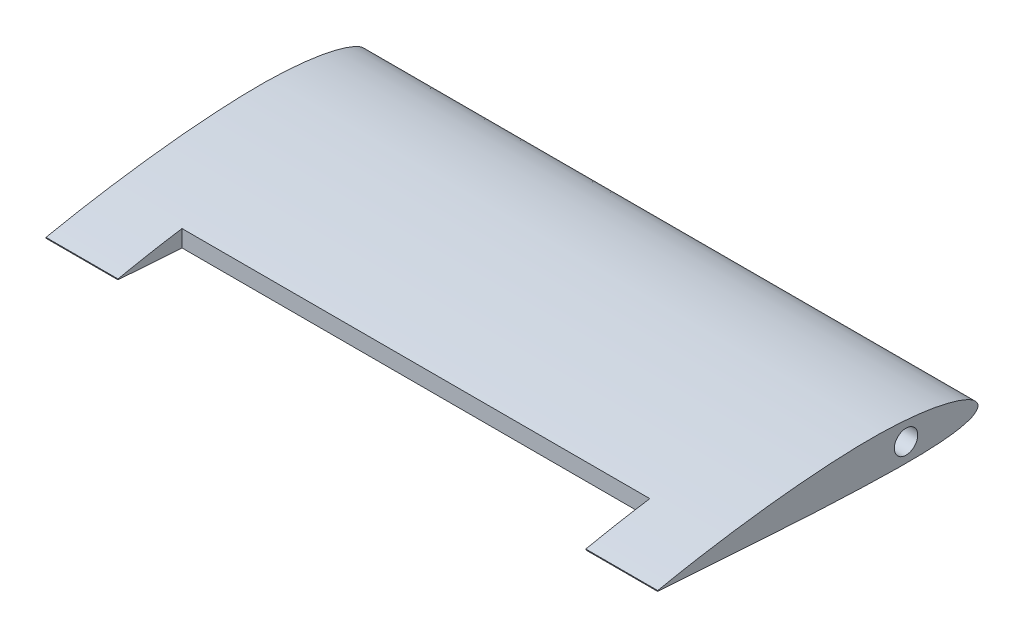
from build123d import *

# Parameters (mm, degrees)
EXTERIOR_DEPTH          = 89
BOSS_EXTRUDE1_DEPTH     = 15
CUT_EXTRUDE1_DEPTH      = 187.402789831
BOSS_EXTRUDE2_DEPTH     = 170
CUT_EXTRUDE6_DEPTH      = 195.066998874
CUT_EXTRUDE2_DEPTH      = 194.966819744
CUT_EXTRUDE2_DEPTH_BACK = 194.966819744
SKETCH13_R              = 3.25
SKETCH19_W              = 37
SKETCH19_H              = 36
CUT_EXTRUDE7_DEPTH      = 23
SKETCH20_W              = 130
SKETCH20_H              = 17.8
CUT_EXTRUDE8_DEPTH      = 266.663791417


with BuildPart() as part:
    # Sketch4 → Exterior (new body)
    with BuildSketch(Plane.XY):
        with BuildLine():
            Line((-30.310889132, 17.5), (30.310889132, 17.5))
            ThreePointArc((30.310889132, 17.5), (0, 35), (-30.310889132, 17.5))
        make_face()
    extrude(amount=EXTERIOR_DEPTH)

    # Sketch5 → Boss-Extrude1 (add)
    with BuildSketch(Plane(origin=(0, 0, 0), x_dir=(-1, 0, 0), z_dir=(0, 0, -1))):
        with BuildLine():
            Line((23.12466216, 17.5), (-23.12466216, 17.5))
            ThreePointArc((-23.12466216, 17.5), (0, 29), (23.12466216, 17.5))
        make_face()
    extrude(amount=BOSS_EXTRUDE1_DEPTH)

    # Sketch8 → Loft9 section 0
    with BuildSketch(Plane(origin=(80, 0, 0), x_dir=(0, 0, -1), z_dir=(1, 0, 0))):
        with BuildLine():
            Line((-89, 21.388673285), (-89, 21.157289024))
            add(Edge.make_bspline(
                [(-89, 21.388673285), (-87.517590216, 21.692439314), (-84.55666408, 22.299173554), (-78.629726947, 23.410490963), (-71.217063181, 24.641831569), (-62.315979948, 25.916239067), (-53.416365024, 26.979047829), (-44.512891772, 27.757252313), (-35.611446145, 28.284249753), (-28.184700481, 28.373454674), (-22.249157522, 28.127729724), (-17.793860325, 27.767671666), (-13.332938365, 27.197496306), (-9.62034211, 26.495369454), (-6.660587516, 25.701015566), (-4.416675535, 24.978830377), (-2.51552544, 24.137376162), (-0.875610556, 23.117206005), (0.554450875, 21.352966349), (-0.931001928, 19.802231536), (-2.540242561, 19.094955092), (-4.433028592, 18.557703614), (-6.669552992, 18.172492853), (-9.641153104, 17.843758377), (-13.350431468, 17.590735708), (-17.804318711, 17.489291467), (-22.255027214, 17.503428063), (-28.18850674, 17.634400274), (-35.606048519, 17.870077207), (-44.505998121, 18.280226492), (-53.403367011, 18.813318665), (-62.302244976, 19.367425301), (-71.202644497, 19.928300878), (-78.617203737, 20.444864827), (-84.55068004, 20.843300056), (-87.516825449, 21.052621243), (-89, 21.157289024)],
                knots=[0, 0, 0, 0, 0.02501249, 0.049959286, 0.099672925, 0.14920632, 0.198581097, 0.24780517, 0.296916575, 0.345952722, 0.370491626, 0.395091204, 0.419814796, 0.444798575, 0.457489819, 0.470406405, 0.483879409, 0.49126412, 0.503458853, 0.513609129, 0.520450991, 0.533235388, 0.545691039, 0.558031884, 0.582609167, 0.607134742, 0.63165208, 0.656174272, 0.705233949, 0.754320379, 0.803437364, 0.852566096, 0.901700994, 0.950848809, 0.975422717, 1, 1, 1, 1], degree=3))
        make_face()
    # Sketch9 → Loft9 section 1
    with BuildSketch(Plane(origin=(-80, 0, 0), x_dir=(0, 0, -1), z_dir=(1, 0, 0))):
        with BuildLine():
            Line((-89, 21.388673285), (-89, 21.157289024))
            add(Edge.make_bspline(
                [(-89, 21.388673285), (-87.517590216, 21.692439314), (-84.55666408, 22.299173554), (-78.629726947, 23.410490963), (-71.217063181, 24.641831569), (-62.315979948, 25.916239067), (-53.416365024, 26.979047829), (-44.512891772, 27.757252313), (-35.611446145, 28.284249753), (-28.184700481, 28.373454674), (-22.249157522, 28.127729724), (-17.793860325, 27.767671666), (-13.332938365, 27.197496306), (-9.62034211, 26.495369454), (-6.660587516, 25.701015566), (-4.416675535, 24.978830377), (-2.51552544, 24.137376162), (-0.875610556, 23.117206005), (0.554450875, 21.352966349), (-0.931001928, 19.802231536), (-2.540242561, 19.094955092), (-4.433028592, 18.557703614), (-6.669552992, 18.172492853), (-9.641153104, 17.843758377), (-13.350431468, 17.590735708), (-17.804318711, 17.489291467), (-22.255027214, 17.503428063), (-28.18850674, 17.634400274), (-35.606048519, 17.870077207), (-44.505998121, 18.280226492), (-53.403367011, 18.813318665), (-62.302244976, 19.367425301), (-71.202644497, 19.928300878), (-78.617203737, 20.444864827), (-84.55068004, 20.843300056), (-87.516825449, 21.052621243), (-89, 21.157289024)],
                knots=[0, 0, 0, 0, 0.02501249, 0.049959286, 0.099672925, 0.14920632, 0.198581097, 0.24780517, 0.296916575, 0.345952722, 0.370491626, 0.395091204, 0.419814796, 0.444798575, 0.457489819, 0.470406405, 0.483879409, 0.49126412, 0.503458853, 0.513609129, 0.520450991, 0.533235388, 0.545691039, 0.558031884, 0.582609167, 0.607134742, 0.63165208, 0.656174272, 0.705233949, 0.754320379, 0.803437364, 0.852566096, 0.901700994, 0.950848809, 0.975422717, 1, 1, 1, 1], degree=3))
        make_face()
    loft()

    # Sketch12 → Cut-Extrude1 (cut, through all)
    with BuildSketch(Plane(origin=(80, 0, 0), x_dir=(0, 0, -1), z_dir=(1, 0, 0))):
        with BuildLine():
            Line((-89, 21.388673285), (-97.240851338, 26.906548897))
            Line((-97.240851338, 26.906548897), (-90.292288108, 42.772216923))
            Line((-90.292288108, 42.772216923), (-30.113825381, 44.023328414))
            Line((-30.113825381, 44.023328414), (6.418630162, 38.518437853))
            Line((6.418630162, 38.518437853), (-0.009919735, 28.917510296))
            Line((-0.009919735, 28.917510296), (-30.620155213, 28.319719466))
            add(Edge.make_bspline(
                [(-89, 21.388673285), (-87.517590216, 21.692439314), (-84.55666408, 22.299173554), (-78.629726947, 23.410490963), (-71.217063181, 24.641831569), (-62.315979948, 25.916239067), (-53.416365024, 26.979047829), (-44.512891772, 27.757252313), (-36.914651442, 28.207095335), (-32.281666301, 28.310724955), (-30.620155213, 28.319719466)],
                knots=[0, 0, 0, 0, 0.02501249, 0.049959286, 0.099672925, 0.14920632, 0.198581097, 0.24780517, 0.296916575, 0.324376959, 0.324376959, 0.324376959, 0.324376959], degree=3))
        make_face()
    extrude(amount=-CUT_EXTRUDE1_DEPTH, mode=Mode.SUBTRACT)

    # Sketch17 → Boss-Extrude2 (add)
    with BuildSketch(Plane.ZY.offset(80)):
        with BuildLine():
            Line((89, 21.388673285), (89, 21.157289024))
            add(Edge.make_bspline(
                [(89, 21.388673285), (87.517590216, 21.692439314), (84.55666408, 22.299173554), (78.629726947, 23.410490963), (71.217063181, 24.641831569), (62.315979948, 25.916239067), (53.416365024, 26.979047829), (44.512891772, 27.757252313), (35.611446145, 28.284249753), (28.184700481, 28.373454674), (22.249157522, 28.127729724), (17.793860325, 27.767671666), (13.332938365, 27.197496306), (9.62034211, 26.495369454), (6.660587516, 25.701015566), (4.416675535, 24.978830377), (2.51552544, 24.137376162), (0.875610556, 23.117206005), (-0.554450875, 21.352966349), (0.931001928, 19.802231536), (2.540242561, 19.094955092), (4.433028592, 18.557703614), (6.669552992, 18.172492853), (9.641153104, 17.843758377), (13.350431468, 17.590735708), (17.804318711, 17.489291467), (22.255027214, 17.503428063), (28.18850674, 17.634400274), (35.606048519, 17.870077207), (44.505998121, 18.280226492), (53.403367011, 18.813318665), (62.302244976, 19.367425301), (71.202644497, 19.928300878), (78.617203737, 20.444864827), (84.55068004, 20.843300056), (87.516825449, 21.052621243), (89, 21.157289024)],
                knots=[0, 0, 0, 0, 0.02501249, 0.049959286, 0.099672925, 0.14920632, 0.198581097, 0.24780517, 0.296916575, 0.345952722, 0.370491626, 0.395091204, 0.419814796, 0.444798575, 0.457489819, 0.470406405, 0.483879409, 0.49126412, 0.503458853, 0.513609129, 0.520450991, 0.533235388, 0.545691039, 0.558031884, 0.582609167, 0.607134742, 0.63165208, 0.656174272, 0.705233949, 0.754320379, 0.803437364, 0.852566096, 0.901700994, 0.950848809, 0.975422717, 1, 1, 1, 1], degree=3))
        make_face()
    extrude(amount=BOSS_EXTRUDE2_DEPTH)

    # Sketch18 → Cut-Extrude6 (cut, through all)
    with BuildSketch(Plane(origin=(-80, 0, 0), x_dir=(0, 0, -1), z_dir=(1, 0, 0))):
        Polygon((-99.866971184, 5.715372229), (-104.390100049, 63.325750406), (31.898914441, 60.82612656), (39.278756274, -3.211855795), align=None)
    extrude(amount=CUT_EXTRUDE6_DEPTH, mode=Mode.SUBTRACT)

    # Sketch13 → Cut-Extrude2 (cut, two sides: drawn at the far end of the back side and taken through both)
    with BuildSketch(Plane.ZY.offset(80).offset(-CUT_EXTRUDE2_DEPTH_BACK)):
        with Locations((20, 22.719194586)):
            Circle(SKETCH13_R)
    extrude(amount=CUT_EXTRUDE2_DEPTH + CUT_EXTRUDE2_DEPTH_BACK, mode=Mode.SUBTRACT)

    # Sketch19 → Cut-Extrude7 (cut)
    with BuildSketch(Plane(origin=(0, 0, 0), x_dir=(1, 0, 0), z_dir=(0, 1, 0))):
        with Locations((-165, -44.499999014)):
            Rectangle(SKETCH19_W, SKETCH19_H)
    extrude(amount=CUT_EXTRUDE7_DEPTH, mode=Mode.SUBTRACT)

    # Sketch20 → Cut-Extrude8 (cut, through all)
    with BuildSketch(Plane(origin=(0, 30, 0), x_dir=(1, 0, 0), z_dir=(0, 1, 0))):
        with Locations((-165, -80.1)):
            Rectangle(SKETCH20_W, SKETCH20_H)
    extrude(amount=-CUT_EXTRUDE8_DEPTH, mode=Mode.SUBTRACT)


solid = part.part
